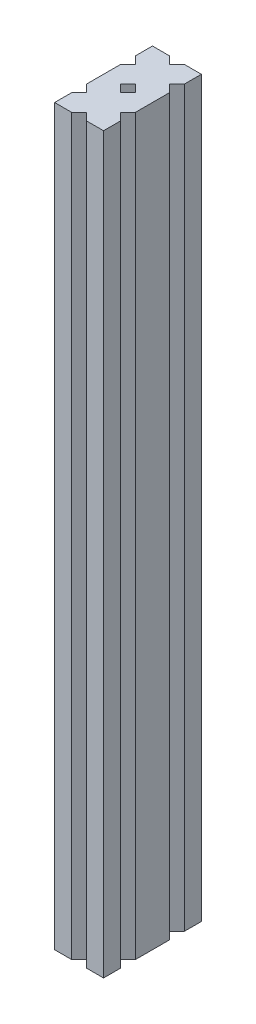
from build123d import *

# Parameters (mm, degrees)
SKIZZE1_W                       = 20
SKIZZE1_H                       = 40
AUFSATZ_LINEAR_AUSTRAGEN1_DEPTH = 300
SCHNITT_LINEAR_AUSTRAGEN1_DEPTH = 304.315017762


with BuildPart() as part:
    # Skizze1 → Aufsatz-Linear austragen1 (new body)
    with BuildSketch(Plane(origin=(0, 0, 0), x_dir=(1, 0, 0), z_dir=(0, 1, 0))):
        with Locations((10, 20)):
            Rectangle(SKIZZE1_W, SKIZZE1_H)
    extrude(amount=AUFSATZ_LINEAR_AUSTRAGEN1_DEPTH)

    # Skizze2 → Schnitt-Linear austragen1 (cut, through all)
    with BuildSketch(Plane(origin=(0, 300, 0), x_dir=(1, 0, 0), z_dir=(0, 1, 0))):
        Polygon((13, 40), (7, 40), (10, 37), align=None)
        Polygon((3, 30), (0, 33), (0, 27), align=None)
        Polygon((20, 27), (20, 33), (17, 30), align=None)
        Polygon((3, 10), (0, 13), (0, 7), align=None)
        Polygon((20, 7), (20, 13), (17, 10), align=None)
        Polygon((10, 3), (7, 0), (13, 0), align=None)
        Polygon((10, 23), (7, 20), (10, 17), (13, 20), align=None)
    extrude(amount=-SCHNITT_LINEAR_AUSTRAGEN1_DEPTH, mode=Mode.SUBTRACT)


solid = part.part
